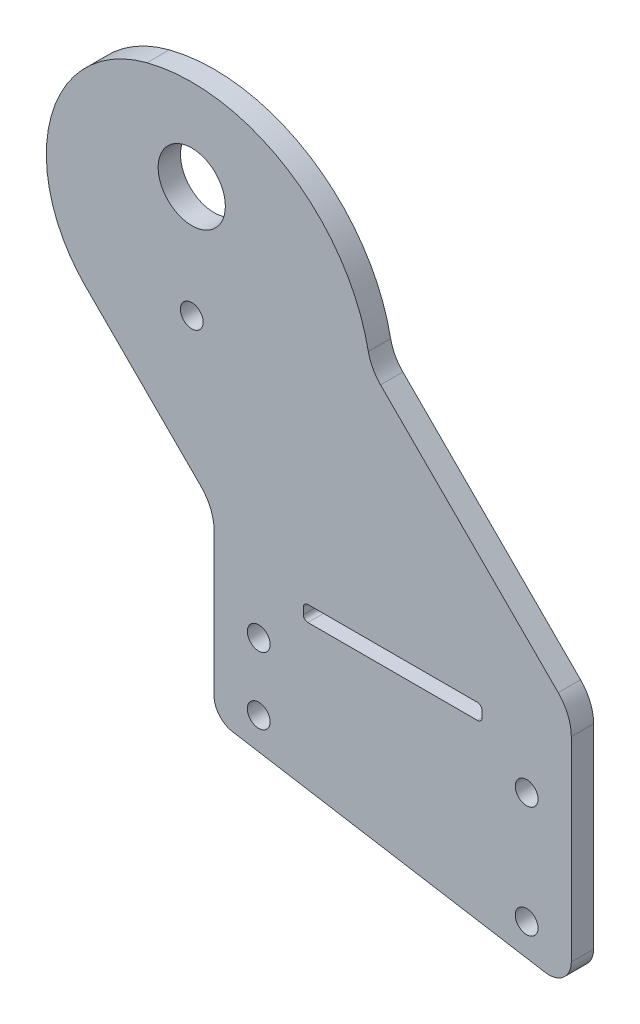
from build123d import *

# Parameters (mm, degrees)
SKETCH_1_R          = 2.55
SKETCH_1_R_2        = 7.525
EXTRUDE_1_DEPTH     = 5
FILLET_1_R          = 10
SKETCH_2_R          = 2.55
CUT_EXTRUDE_1_DEPTH = 112.121375081
FILLET_2_R          = 30
SKETCH_3_W          = 40
SKETCH_3_H          = 3
CUT_EXTRUDE_2_DEPTH = 112.121375081
SKETCH_5_W          = 40
SKETCH_5_H          = 0.5
CUT_EXTRUDE_4_DEPTH = 112.121375081
FILLET_3_R          = 1
CUT_EXTRUDE_5_DEPTH = 112.121375081
FILLET_4_R          = 5


with BuildPart() as part:
    # ｽｹｯﾁ1 → ﾎﾞｽ - 押し出し1 (new body)
    with BuildSketch(Plane.XY):
        with BuildLine():
            Line((40, 33.6), (85, -11.4))
            Line((85, -11.4), (85, -71.4))
            Line((85, -71.4), (5, -71.4))
            Line((5, -71.4), (5, -11.4))
            Line((5, -11.4), (-40, 33.6))
            ThreePointArc((-40, 33.6), (0, 68.911288741), (40, 33.6))
        make_face()
        with Locations((75, -31.4)):
            Circle(SKETCH_1_R, mode=Mode.SUBTRACT)
        with Locations((75, -56.4)):
            Circle(SKETCH_1_R, mode=Mode.SUBTRACT)
        with Locations((0, 23.6)):
            Circle(SKETCH_1_R, mode=Mode.SUBTRACT)
        with Locations((0, 48.6)):
            Circle(SKETCH_1_R_2, mode=Mode.SUBTRACT)
    extrude(amount=EXTRUDE_1_DEPTH)

    # ﾌｨﾚｯﾄ1
    fillet_1_edges = [part.edges().sort_by_distance(p)[0] for p in [
        (85, -11.4, 2.5),
        (40, 33.6, 2.5),
        (5, -11.4, 2.5),
    ]]
    fillet(fillet_1_edges, radius=FILLET_1_R)

    # ｽｹｯﾁ2 → ｶｯﾄ - 押し出し1 (cut, through all)
    with BuildSketch(Plane.XY.offset(5)):
        with Locations((15, -46.4)):
            Circle(SKETCH_2_R)
        with Locations((15, -31.4)):
            Circle(SKETCH_2_R)
    extrude(amount=-CUT_EXTRUDE_1_DEPTH, mode=Mode.SUBTRACT)

    # ﾌｨﾚｯﾄ2
    fillet_2_edges = [part.edges().sort_by_distance(p)[0] for p in [
        (-40, 33.6, 2.5),
    ]]
    fillet(fillet_2_edges, radius=FILLET_2_R)

    # ｽｹｯﾁ3 → ｶｯﾄ - 押し出し2 (cut, through all)
    with BuildSketch(Plane(origin=(0, 0, 0), x_dir=(-1, 0, 0), z_dir=(0, 0, -1))):
        with Locations((-45, -21.4)):
            Rectangle(SKETCH_3_W, SKETCH_3_H)
    extrude(amount=-CUT_EXTRUDE_2_DEPTH, mode=Mode.SUBTRACT)

    # ｽｹｯﾁ5 → ｶｯﾄ - 押し出し4 (cut, through all)
    with BuildSketch(Plane(origin=(0, 0, 0), x_dir=(-1, 0, 0), z_dir=(0, 0, -1))):
        with Locations((-45, -19.65)):
            Rectangle(SKETCH_5_W, SKETCH_5_H)
    extrude(amount=-CUT_EXTRUDE_4_DEPTH, mode=Mode.SUBTRACT)

    # ﾌｨﾚｯﾄ3
    fillet_3_edges = [part.edges().sort_by_distance(p)[0] for p in [
        (65, -19.4, 2.5),
        (65, -22.9, 2.5),
        (25, -22.9, 2.5),
        (25, -19.4, 2.5),
    ]]
    fillet(fillet_3_edges, radius=FILLET_3_R)

    # ｽｹｯﾁ6 → ｶｯﾄ - 押し出し5 (cut, through all)
    with BuildSketch(Plane(origin=(0, 0, 0), x_dir=(-1, 0, 0), z_dir=(0, 0, -1))):
        Polygon((-5, -51.829889619), (-122.420662288, -71.4), (-5, -71.4), align=None)
    extrude(amount=-CUT_EXTRUDE_5_DEPTH, mode=Mode.SUBTRACT)

    # ﾌｨﾚｯﾄ4
    fillet_4_edges = [part.edges().sort_by_distance(p)[0] for p in [
        (85, -65.163222952, 2.5),
        (5, -51.829889619, 2.5),
    ]]
    fillet(fillet_4_edges, radius=FILLET_4_R)


solid = part.part
